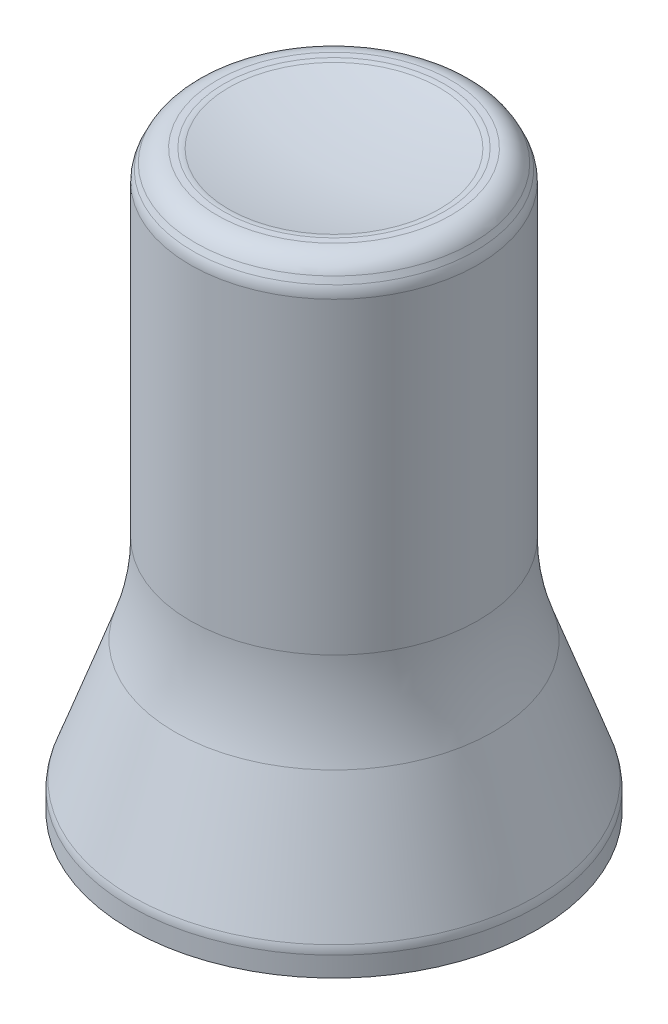
from build123d import *

# Parameters (mm, degrees)
FILLET1_R           = 11
FILLET2_R           = 1
BOSS_EXTRUDE1_DEPTH = 10.425
CHAMFER1_SIZE       = 0.35


with BuildPart() as part:
    # Sketch1 → Revolve1 (revolve)
    with BuildSketch(Plane.XY, mode=Mode.PRIVATE) as revolve1_sk:
        with BuildLine():
            Line((0, 0), (8.5, 0))
            Line((8.5, 0), (8.5, 1))
            Line((8.5, 1), (6, 8))
            Line((6, 8), (6, 23))
            Line((6, 23), (5.5, 24))
            Line((5.5, 24), (4.5, 24))
            add(Edge.make_bspline(
                [(4.5, 24), (2.277777778, 23.5), (0, 23.5)],
                knots=[0, 0, 0, 1, 1, 1], degree=2))
            Line((0, 23.5), (0, 0))
        make_face()
    revolve(revolve1_sk.sketch.rotate(Axis((0, 23.5, 0), (0, -1, 0)), 180), axis=Axis((0, 23.5, 0), (0, -1, 0)))

    # Fillet1
    fillet1_edges = [part.edges().sort_by_distance(p)[0] for p in [
        (6, 8, 0),
    ]]
    fillet(fillet1_edges, radius=FILLET1_R)

    # Fillet2
    fillet2_edges = [part.edges().sort_by_distance(p)[0] for p in [
        (4.5, 24, 0),
        (5.5, 24, 0),
        (6, 23, 0),
        (8.5, 1, 0),
    ]]
    fillet(fillet2_edges, radius=FILLET2_R)

    # Sketch3 → Cut-Revolve1 (revolve, cut)
    with BuildSketch(Plane.XY, mode=Mode.PRIVATE) as cut_revolve1_sk:
        Polygon((0, 0), (3.875, 0), (3.875, 6.5), (3.05, 7.325), (3.05, 17.75), (0, 17.75), align=None)
    revolve(cut_revolve1_sk.sketch.rotate(Axis((0, 17.75, 0), (0, -1, 0)), 180), axis=Axis((0, 17.75, 0), (0, -1, 0)), mode=Mode.SUBTRACT)

    # Sketch4 → Boss-Extrude1 (add)
    with BuildSketch(Plane.XZ.offset(-17.75)):
        with BuildLine():
            Line((-2.655654345, 1.5), (2.655654345, 1.5))
            ThreePointArc((2.655654345, 1.5), (0, 3.05), (-2.655654345, 1.5))
        make_face()
        with BuildLine():
            ThreePointArc((-0.099986562, -3.048360656), (0, -3.05), (0.099986562, -3.048360656))
            ThreePointArc((0.099986562, -3.048360656), (0, -2.95), (-0.099986562, -3.048360656))
        make_face()
    extrude(amount=BOSS_EXTRUDE1_DEPTH)

    # Chamfer1
    # the kernel refuses this chamfer: 0.35 mm, written as the material it takes off along each edge
    with BuildSketch(Plane(origin=(-3.555743391, 7.325, 1.5), x_dir=(0, -0.02749587661058614, 0.9996219169112968), z_dir=(1, 0, 0))) as chamfer1_piece_1_section:
        Polygon((CHAMFER1_SIZE * 0.999621916911, -CHAMFER1_SIZE * 0.0274958766106), (-CHAMFER1_SIZE * 0.0274958766106, -CHAMFER1_SIZE * 0.999621916911), (0, 0), align=None)
    chamfer1_piece_1 = extrude(amount=7.111486782, mode=Mode.PRIVATE)
    chamfer1_piece_1 = chamfer1_piece_1 & Plane(origin=(0, 7.499624527, 0), x_dir=(-1, 0, 0), z_dir=(0, 1, 0)) * Cylinder(3.05, 16, mode=Mode.PRIVATE)
    add(chamfer1_piece_1, mode=Mode.SUBTRACT)


solid = part.part
